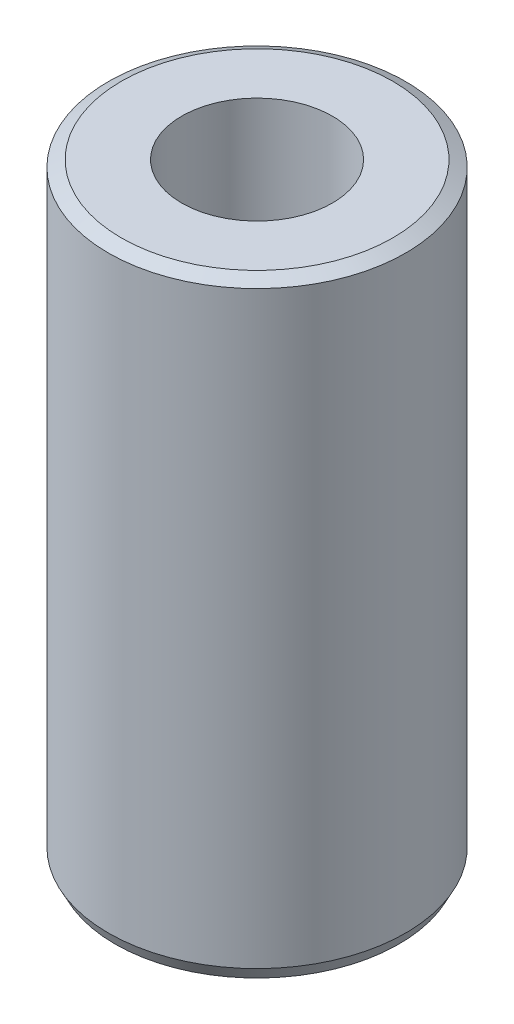
from build123d import *
from OCP.BRepFilletAPI import BRepFilletAPI_MakeChamfer

# Parameters (mm, degrees)
SKETCH1_R           = 50
BOSS_EXTRUDE1_DEPTH = 204.716866867
SKETCH2_R           = 25.354973633
CUT_EXTRUDE1_DEPTH  = 217.584846146
CHAMFER1_SIZE       = 2.240201055
CHAMFER1_SIZE2      = 4.335184426


with BuildPart() as part:
    # Sketch1 → Boss-Extrude1 (new body)
    with BuildSketch(Plane(origin=(0, 0, 0), x_dir=(1, 0, 0), z_dir=(0, 1, 0))):
        Circle(SKETCH1_R)
    extrude(amount=BOSS_EXTRUDE1_DEPTH)

    # Sketch2 → Cut-Extrude1 (cut, through all)
    with BuildSketch(Plane(origin=(0, 0, 0), x_dir=(1, 0, 0), z_dir=(0, 1, 0))):
        Circle(SKETCH2_R)
    extrude(amount=CUT_EXTRUDE1_DEPTH, mode=Mode.SUBTRACT)

    # Chamfer1: one chamfer whose edges measure the first distance from different faces: ONE call of the kernel's chamfer builder (chamfer() names one face for all edges)
    chamfer1_edges_1 = [part.edges().sort_by_distance(p)[0] for p in [
        (-50, 204.716866867, 0),
    ]]
    chamfer1_side_1 = [part.faces().sort_by_distance(p)[0] for p in [
        (-50, 102.358433434, 0),
    ]]
    chamfer1_edges_2 = [part.edges().sort_by_distance(p)[0] for p in [
        (-50, 0, 0),
    ]]
    chamfer1_side_2 = [part.faces().sort_by_distance(p)[0] for p in [
        (-48.585786438, 0, 0),
    ]]
    chamfer1 = BRepFilletAPI_MakeChamfer(part.part.solid().wrapped)
    for e in chamfer1_edges_1:
        chamfer1.Add(CHAMFER1_SIZE, CHAMFER1_SIZE2, e.wrapped, chamfer1_side_1[0].wrapped)  # the first distance lies on this face
    for e in chamfer1_edges_2:
        chamfer1.Add(CHAMFER1_SIZE, CHAMFER1_SIZE2, e.wrapped, chamfer1_side_2[0].wrapped)  # the first distance lies on this face
    add(Compound.cast(chamfer1.Shape()), mode=Mode.REPLACE)


solid = part.part
